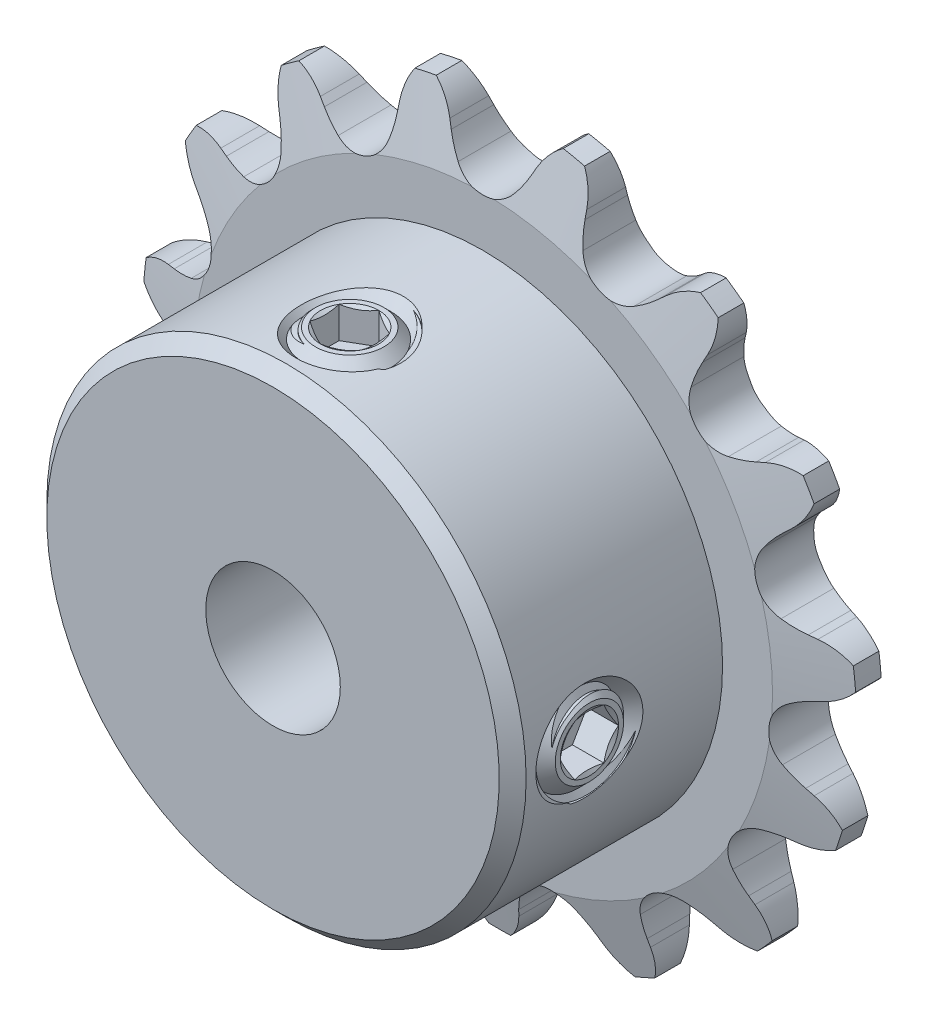
from build123d import *

# Parameters (mm, degrees)
CUT_EXTRUDE1_DEPTH      = 24.859401731
CIRPATTERN1_COUNT       = 15
BOSS_EXTRUDE1_START     = 1.397
SKETCH2_R               = 11.3109375
BOSS_EXTRUDE1_DEPTH     = 9.906
CUT_EXTRUDE2_DEPTH      = 27.334822136
CUT_EXTRUDE2_DEPTH_BACK = 27.334822136
SKETCH3_OUTSIDE_W       = 45.402
SKETCH3_OUTSIDE_H       = 45.226
SKETCH3_OUTSIDE_R       = 16.891
SKETCH3_OUTSIDE_R_2     = 3.175
SKETCH4_W               = 1.74625
SKETCH4_H               = 5.461
CUT_EXTRUDE4_REACH      = 36.677
CUT_EXTRUDE4_END_RADIUS = 3.175
SKETCH6_R               = 1.751541667
CUT_SWEEP1_PITCH        = 1.058333333
CIRPATTERN2_COUNT       = 2
CIRPATTERN2_ANGLE       = 90
CUT_SWEEP2_PITCH        = 1.058333333
CUT_EXTRUDE6_DEPTH      = 1.48828125
CIRPATTERN3_COUNT       = 2
CIRPATTERN3_ANGLE       = 90


with BuildPart() as part:
    # Sketch1 → Revolve1 (revolve)
    with BuildSketch(Plane(origin=(0, 0, 0), x_dir=(0, 0, -1), z_dir=(1, 0, 0)), mode=Mode.PRIVATE) as revolve1_sk:
        Polygon((1.397, 0), (-1.397, 0), (-1.397, 13.667200598), (-0.60325, 16.842200598), (0.60325, 16.842200598), (1.397, 13.667200598), align=None)
    revolve(revolve1_sk.sketch.rotate(Axis((0, 0, -1.397), (0, 0, 1)), 90), axis=Axis((0, 0, -1.397), (0, 0, 1)))

    # Sketch0 → Cut-Extrude1 (cut, symmetric)
    with BuildSketch(Plane.XY):
        with BuildLine():
            Line((5.21001143, -14.689898803), (4.989946521, -14.395017265))
            ThreePointArc((4.989946521, -14.395017265), (4.64077593, -13.983289437), (4.243180112, -13.618108014))
            ThreePointArc((4.243180112, -13.618108014), (2.822100052, -13.276936877), (1.662645621, -14.166617553))
            ThreePointArc((1.662645621, -14.166617553), (1.447956434, -14.661944171), (1.296438022, -15.180096732))
            Line((1.296438022, -15.180096732), (1.21533785, -15.538992884))
            ThreePointArc((1.21533785, -15.538992884), (0.151822505, -17.149815568), (-1.711200673, -17.654750459))
            ThreePointArc((-1.711200673, -17.654750459), (3.687830775, -17.349879703), (8.744093538, -15.432409071))
            ThreePointArc((8.744093538, -15.432409071), (6.836761653, -15.728887888), (5.21001143, -14.689898803))
        make_face()
    cut_extrude1 = extrude(amount=CUT_EXTRUDE1_DEPTH, both=True, mode=Mode.SUBTRACT)

    # CirPattern1: Cut-Extrude1 ×15 about axis
    cirpattern1_axis = Axis((0, 0, 0), (0, 0, 1))
    for i in range(1, CIRPATTERN1_COUNT):
        add(cut_extrude1.rotate(cirpattern1_axis, i * 360 / CIRPATTERN1_COUNT), mode=Mode.SUBTRACT)

    # Sketch2 → Boss-Extrude1 (add)
    with BuildSketch(Plane.XY.offset(BOSS_EXTRUDE1_START)):
        Circle(SKETCH2_R)
    extrude(amount=BOSS_EXTRUDE1_DEPTH)

    # Sketch3 outside → Cut-Extrude2 (cut, two sides: drawn at the far end of the back side and taken through both)
    # profile 1 of 2: a face of its own
    with BuildSketch(Plane.XY.offset(-CUT_EXTRUDE2_DEPTH_BACK)):
        with Locations((0, -0.134)):
            Rectangle(SKETCH3_OUTSIDE_W, SKETCH3_OUTSIDE_H)
        Circle(SKETCH3_OUTSIDE_R, mode=Mode.SUBTRACT)
    # profile 2 of 2: a face of its own
    with BuildSketch(Plane.XY.offset(-CUT_EXTRUDE2_DEPTH_BACK)):
        with Locations(Location((0, 0, 0), (0, 0, 180))):
            Circle(SKETCH3_OUTSIDE_R_2)
    extrude(amount=CUT_EXTRUDE2_DEPTH + CUT_EXTRUDE2_DEPTH_BACK, mode=Mode.SUBTRACT)

    # Sketch4 → Cut-Revolve1 (revolve, cut)
    with BuildSketch(Plane(origin=(0, 0, 0), x_dir=(0, 0, -1), z_dir=(1, 0, 0))):
        Polygon((-11.303, 11.3109375), (-11.303, 10.6759375), (-10.668, 11.3109375), align=None)
        with Locations((-2.270125, 14.111700598)):
            Rectangle(SKETCH4_W, SKETCH4_H)
    revolve(axis=Axis((0, 0, -1.397), (0, 0, 1)), mode=Mode.SUBTRACT)

    # Cut-Extrude4: up to this cylinder (the profile starts outside it)
    cut_extrude4_end = Plane(origin=(0, 0, 7.6835), z_dir=(0, 0, -1)) * Cylinder(CUT_EXTRUDE4_END_RADIUS, 80.704, mode=Mode.PRIVATE)
    # Sketch6 → Cut-Extrude4 (cut, up to the surface)
    with BuildSketch(Plane(origin=(0, 11.3109375, 0), x_dir=(-1, 0, 0), z_dir=(0, 1, 0)), mode=Mode.PRIVATE) as cut_extrude4_sk1:
        with Locations(Location((0, 7.6835, 0), (0, 0, 90))):
            Circle(SKETCH6_R)
    cut_extrude4_tool1 = extrude(cut_extrude4_sk1.sketch, amount=-CUT_EXTRUDE4_REACH, mode=Mode.PRIVATE) - cut_extrude4_end
    cut_extrude4 = cut_extrude4_tool1.solids().sort_by_distance((0, 11.310937, 7.6835))[0]
    add(cut_extrude4, mode=Mode.SUBTRACT)

    # Cut-Sweep1: arcs per turn and ends read off the stored shape
    # Cut-Sweep1: the profile of Sketch8 screwed along a right-hand helix through 12.6875 turns, 8 arcs to a turn; built about Z, then put on its axis
    cut_sweep1_z = Axis((0, 0, 0), (0, 0, 1))
    cut_sweep1_corners = [(2.413, 0, -1.521354167), (2.413, 0, -1.653645833), (1.668308364, 0, -2.08359375), (1.668308364, 0, -1.09140625)]
    with BuildLine(mode=Mode.PRIVATE) as cut_sweep1_profile:
        Line(cut_sweep1_corners[0], cut_sweep1_corners[1])
        Line(cut_sweep1_corners[1], cut_sweep1_corners[2])
        Line(cut_sweep1_corners[2], cut_sweep1_corners[3])
        Line(cut_sweep1_corners[3], cut_sweep1_corners[0])
    cut_sweep1_cap = Face(cut_sweep1_profile.wire())
    cut_sweep1_turn_angles = [0, 22.5, 45, 67.5, 90, 112.5, 135, 157.5, 180, 202.5, 225, 247.5, 270, 292.5, 315, 337.5, 360]
    cut_sweep1_turn_weights = [1, 0.9238795325112867, 1, 0.9238795325112867, 1, 0.9238795325112867, 1, 0.9238795325112867, 1, 0.9238795325112867, 1, 0.9238795325112867, 1, 0.9238795325112867, 1, 0.9238795325112867, 1]
    cut_sweep1_turn_rails = [Edge.make_bspline([Vector(p[0], p[1], 0).rotate(cut_sweep1_z, cut_sweep1_turn_angles[k]) / cut_sweep1_turn_weights[k] + Vector(0, 0, p[2] + CUT_SWEEP1_PITCH * cut_sweep1_turn_angles[k] / 360) for k in range(17)], [0, 0, 0, 1, 1, 2, 2, 3, 3, 4, 4, 5, 5, 6, 6, 7, 7, 8, 8, 8], 2, cut_sweep1_turn_weights) for p in cut_sweep1_corners]
    cut_sweep1_turn_sides = [Face.make_surface_from_curves(cut_sweep1_turn_rails[p[0]], cut_sweep1_turn_rails[p[1]]) for p in [(0, 1), (1, 2), (2, 3), (3, 0)]]
    cut_sweep1_last_angles = [4320, 4342.5, 4365, 4387.5, 4410, 4432.5, 4455, 4477.5, 4500, 4522.5, 4545, 4556.25, 4567.5]
    cut_sweep1_last_weights = [1, 0.9238795325112867, 1, 0.9238795325112867, 1, 0.9238795325112867, 1, 0.9238795325112867, 1, 0.9238795325112867, 1, 0.9807852804032304, 1]
    cut_sweep1_last_rails = [Edge.make_bspline([Vector(p[0], p[1], 0).rotate(cut_sweep1_z, cut_sweep1_last_angles[k]) / cut_sweep1_last_weights[k] + Vector(0, 0, p[2] + CUT_SWEEP1_PITCH * cut_sweep1_last_angles[k] / 360) for k in range(13)], [0, 0, 0, 1, 1, 2, 2, 3, 3, 4, 4, 5, 5, 6, 6, 6], 2, cut_sweep1_last_weights) for p in cut_sweep1_corners]
    cut_sweep1_last_sides = [Face.make_surface_from_curves(cut_sweep1_last_rails[p[0]], cut_sweep1_last_rails[p[1]]) for p in [(0, 1), (1, 2), (2, 3), (3, 0)]]
    cut_sweep1 = Plane(origin=(0, 11.3109375, 7.6835), x_dir=(0, 0, 1), z_dir=(0, -1, 0)) * Solid(Shell([*[p.moved(Location((0, 0, CUT_SWEEP1_PITCH * i))) for i in range(12) for p in cut_sweep1_turn_sides], *cut_sweep1_last_sides, cut_sweep1_cap, cut_sweep1_cap.rotate(cut_sweep1_z, 4567.5).moved(Location((0, 0, CUT_SWEEP1_PITCH * 4567.5 / 360)))]))
    add(cut_sweep1, mode=Mode.SUBTRACT)

    # Cut-Extrude5: read off the stored shape, not the designer's step
    # Cut-Extrude5 outline → Cut-Extrude5 (revolve, cut)
    with BuildSketch(Plane.XY.offset(7.6835)):
        Polygon((1.751541667, 11.310939734), (1.751541667, 10.534911223), (2.527570178, 11.310939734), align=None)
    cut_extrude5 = revolve(axis=Axis((0, 0, 7.6835), (0, 1, 0)), mode=Mode.SUBTRACT)

    # CirPattern2: Cut-Extrude4, Cut-Sweep1, Cut-Extrude5 ×2 about axis
    cirpattern2_axis = Axis((0, 0, 11.303), (0, 0, -1))
    add([cut_extrude4.rotate(cirpattern2_axis, i * CIRPATTERN2_ANGLE / (CIRPATTERN2_COUNT - 1)) for i in range(1, CIRPATTERN2_COUNT)], mode=Mode.SUBTRACT)
    add([cut_sweep1.rotate(cirpattern2_axis, i * CIRPATTERN2_ANGLE / (CIRPATTERN2_COUNT - 1)) for i in range(1, CIRPATTERN2_COUNT)], mode=Mode.SUBTRACT)
    add([cut_extrude5.rotate(cirpattern2_axis, i * CIRPATTERN2_ANGLE / (CIRPATTERN2_COUNT - 1)) for i in range(1, CIRPATTERN2_COUNT)], mode=Mode.SUBTRACT)


with BuildPart() as body_2:
    # Sketch10 → Revolve2 (revolve)
    with BuildSketch(Plane(origin=(0, 0, 0), x_dir=(0, 0, -1), z_dir=(1, 0, 0))):
        Polygon((-7.6835, 11.3109375), (-7.6835, 6.5484375), (-9.294524392, 6.5484375), (-10.0965, 7.350413108), (-10.0965, 10.508961892), (-9.294524392, 11.3109375), align=None)
    revolve(axis=Axis((0, 11.3109375, 7.6835), (0, -1, 0)))

    # Cut-Sweep2: arcs per turn and ends read off the stored shape
    # Cut-Sweep2: the profile of Sketch12 screwed along a right-hand helix through 5.5 turns, 8 arcs to a turn; built about Z, then put on its axis
    cut_sweep2_z = Axis((0, 0, 0), (0, 0, 1))
    cut_sweep2_corners = [(2.470283972, 0, -0.49609375), (2.470283972, 0, 0.49609375), (1.725592336, 0, 0.066145833), (1.725592336, 0, -0.066145833)]
    with BuildLine(mode=Mode.PRIVATE) as cut_sweep2_profile:
        Line(cut_sweep2_corners[0], cut_sweep2_corners[1])
        Line(cut_sweep2_corners[1], cut_sweep2_corners[2])
        Line(cut_sweep2_corners[2], cut_sweep2_corners[3])
        Line(cut_sweep2_corners[3], cut_sweep2_corners[0])
    cut_sweep2_cap = Face(cut_sweep2_profile.wire())
    cut_sweep2_turn_angles = [0, 22.5, 45, 67.5, 90, 112.5, 135, 157.5, 180, 202.5, 225, 247.5, 270, 292.5, 315, 337.5, 360]
    cut_sweep2_turn_weights = [1, 0.9238795325112867, 1, 0.9238795325112867, 1, 0.9238795325112867, 1, 0.9238795325112867, 1, 0.9238795325112867, 1, 0.9238795325112867, 1, 0.9238795325112867, 1, 0.9238795325112867, 1]
    cut_sweep2_turn_rails = [Edge.make_bspline([Vector(p[0], p[1], 0).rotate(cut_sweep2_z, cut_sweep2_turn_angles[k]) / cut_sweep2_turn_weights[k] + Vector(0, 0, p[2] + CUT_SWEEP2_PITCH * cut_sweep2_turn_angles[k] / 360) for k in range(17)], [0, 0, 0, 1, 1, 2, 2, 3, 3, 4, 4, 5, 5, 6, 6, 7, 7, 8, 8, 8], 2, cut_sweep2_turn_weights) for p in cut_sweep2_corners]
    cut_sweep2_turn_sides = [Face.make_surface_from_curves(cut_sweep2_turn_rails[p[0]], cut_sweep2_turn_rails[p[1]]) for p in [(0, 1), (1, 2), (2, 3), (3, 0)]]
    cut_sweep2_last_angles = [1800, 1822.5, 1845, 1867.5, 1890, 1912.5, 1935, 1957.5, 1980]
    cut_sweep2_last_weights = [1, 0.9238795325112867, 1, 0.9238795325112867, 1, 0.9238795325112867, 1, 0.9238795325112693, 1]
    cut_sweep2_last_rails = [Edge.make_bspline([Vector(p[0], p[1], 0).rotate(cut_sweep2_z, cut_sweep2_last_angles[k]) / cut_sweep2_last_weights[k] + Vector(0, 0, p[2] + CUT_SWEEP2_PITCH * cut_sweep2_last_angles[k] / 360) for k in range(9)], [0, 0, 0, 1, 1, 2, 2, 3, 3, 4, 4, 4], 2, cut_sweep2_last_weights) for p in cut_sweep2_corners]
    cut_sweep2_last_sides = [Face.make_surface_from_curves(cut_sweep2_last_rails[p[0]], cut_sweep2_last_rails[p[1]]) for p in [(0, 1), (1, 2), (2, 3), (3, 0)]]
    cut_sweep2 = Plane(origin=(0, 11.3109375, 7.6835), x_dir=(0, 0, 1), z_dir=(0, -1, 0)) * Solid(Shell([*[p.moved(Location((0, 0, CUT_SWEEP2_PITCH * i))) for i in range(5) for p in cut_sweep2_turn_sides], *cut_sweep2_last_sides, cut_sweep2_cap, cut_sweep2_cap.rotate(cut_sweep2_z, 1980).moved(Location((0, 0, CUT_SWEEP2_PITCH * 1980 / 360)))]))
    add(cut_sweep2, mode=Mode.SUBTRACT)

    # Sketch13 → Cut-Extrude6 (cut)
    with BuildSketch(Plane(origin=(0, 11.3109375, 0), x_dir=(1, 0, 0), z_dir=(0, 1, 0))):
        Polygon((0, -6.308684671), (-1.190625, -6.996092336), (-1.190625, -8.370907664), (0, -9.058315329), (1.190625, -8.370907664), (1.190625, -6.996092336), align=None)
    extrude(amount=-CUT_EXTRUDE6_DEPTH, mode=Mode.SUBTRACT)

    # Cut-Extrude7 cone 1 section (through the dimple's axis) → Cut-Extrude7 (revolve, cut)
    with BuildSketch(Plane(origin=(0, 11.3109375, 7.6835), x_dir=(0, 0, 1), z_dir=(1, 0, 0))):
        Polygon((0, 0), (1.374815329, 0), (0, 0.79375), align=None)
    revolve(axis=Axis((0, 11.3109375, 7.6835), (0, -1, 0)), mode=Mode.SUBTRACT)


with BuildPart() as cirpattern3_1:
    # CirPattern3: pattern copy
    add(body_2.part.rotate(Axis((0, 0, 11.303), (0, 0, -1)), 1 * CIRPATTERN3_ANGLE / (CIRPATTERN3_COUNT - 1)))


solid = Compound([part.part, body_2.part, cirpattern3_1.part])
